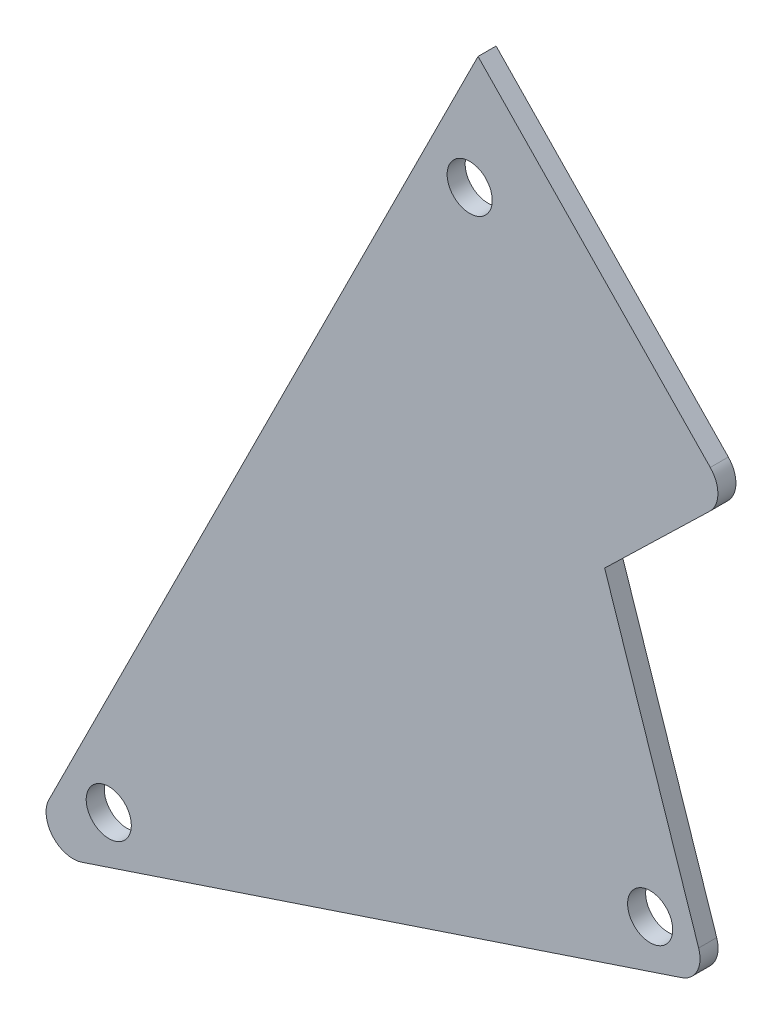
from build123d import *

# Parameters (mm, degrees)
SKETCH1_R           = 3.175
BOSS_EXTRUDE1_DEPTH = 2.54
FILLET1_R           = 3.81


with BuildPart() as part:
    # Sketch1 → Boss-Extrude1 (new body)
    with BuildSketch(Plane.XY):
        Polygon((-24.223713703, 118.151604251), (-88.735511623, -10.871991588), (8.032185257, 21.383907372), (-6.404519195, 64.694020727), (11.113552526, 81.656157748), align=None)
        with Locations((-76.2, 0)):
            Circle(SKETCH1_R, mode=Mode.SUBTRACT)
        with Locations((0, 25.4)):
            Circle(SKETCH1_R, mode=Mode.SUBTRACT)
        with Locations((-25.4, 101.6)):
            Circle(SKETCH1_R, mode=Mode.SUBTRACT)
    extrude(amount=BOSS_EXTRUDE1_DEPTH)

    # Fillet1
    fillet1_edges = [part.edges().sort_by_distance(p)[0] for p in [
        (-88.735511623, -10.871991588, 1.27),
        (8.032185257, 21.383907372, 1.27),
        (11.113552526, 81.656157748, 1.27),
    ]]
    fillet(fillet1_edges, radius=FILLET1_R)


solid = part.part
